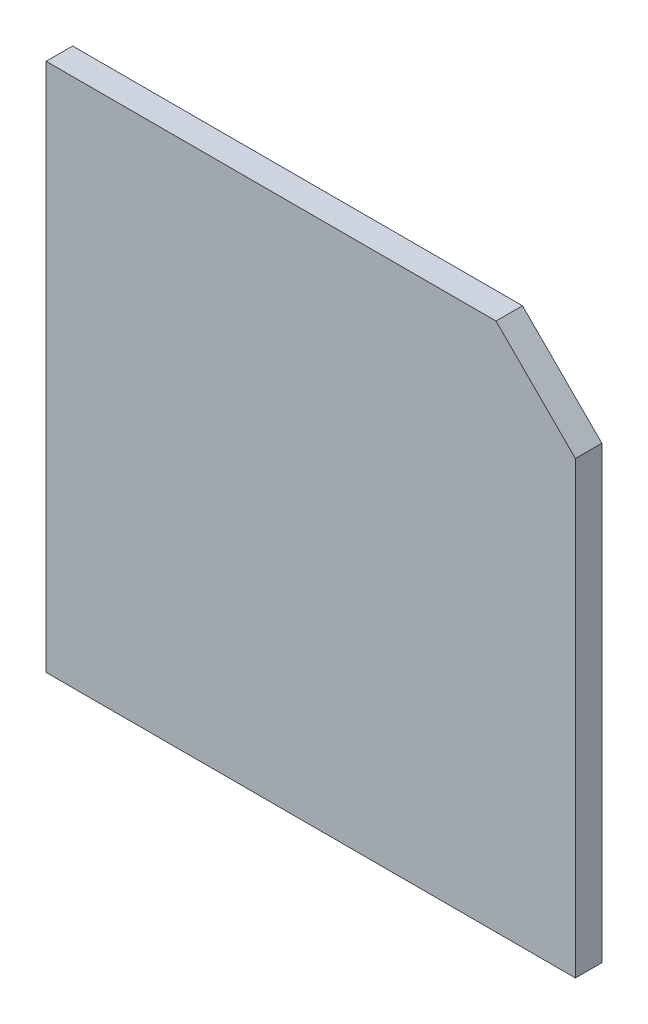
from build123d import *

# Parameters (mm, degrees)
SKETCH3_W           = 500
SKETCH3_H           = 500
BOSS_EXTRUDE2_DEPTH = 25
CUT_EXTRUDE1_DEPTH  = 25.4


with BuildPart() as part:
    # Sketch3 → Boss-Extrude2 (new body)
    with BuildSketch(Plane.XY):
        Rectangle(SKETCH3_W, SKETCH3_H)
    extrude(amount=BOSS_EXTRUDE2_DEPTH)

    # Sketch4 → Cut-Extrude1 (cut)
    with BuildSketch(Plane.XY.offset(25)):
        Polygon((175, 250), (250, 175), (250, 250), align=None)
    extrude(amount=-CUT_EXTRUDE1_DEPTH, mode=Mode.SUBTRACT)


solid = part.part
